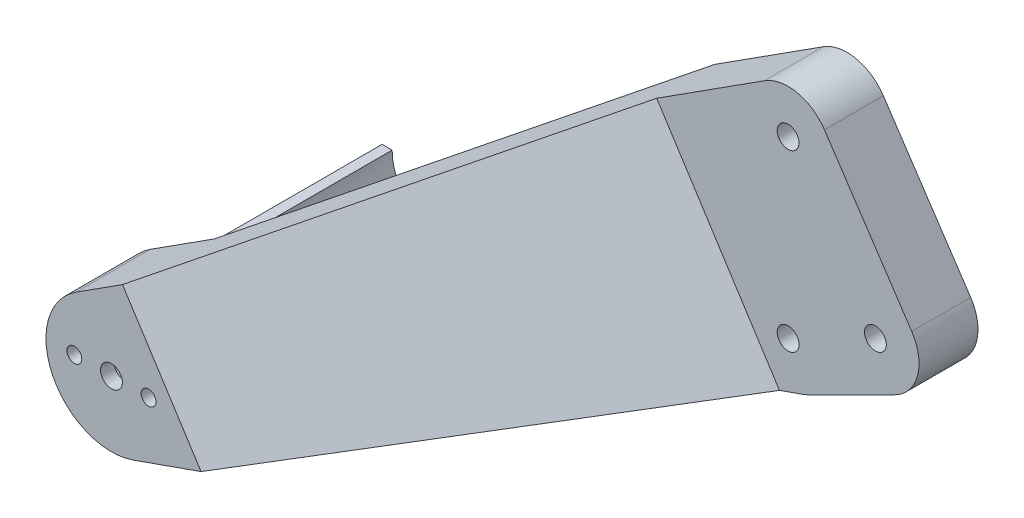
from build123d import *

# Parameters (mm, degrees)
BOSS_EXTRUDE1_DEPTH = 17
SKETCH2_R           = 2.5
CUT_EXTRUDE1_DEPTH  = 127.546434165
SKETCH3_R           = 1.7
CUT_EXTRUDE2_DEPTH  = 127.546434165
SKETCH7_R           = 12.7
CUT_EXTRUDE6_DEPTH  = 13
SKETCH4_R           = 5.5
CUT_EXTRUDE3_DEPTH  = 0.9
BOSS_EXTRUDE2_START = 60
BOSS_EXTRUDE2_DEPTH = 60
BOSS_EXTRUDE4_START = 51.5
BOSS_EXTRUDE4_DEPTH = 51.5
SKETCH12_R          = 2.5
CUT_EXTRUDE7_DEPTH  = 148.152981621
CUT_EXTRUDE8_DEPTH  = 137.561092173
CUT_EXTRUDE9_DEPTH  = 137.561092173


with BuildPart() as part:
    # Sketch1 → Boss-Extrude1 (new body)
    with BuildSketch(Plane.XY):
        with BuildLine():
            Line((3.328897286, -9.429657621), (-95.00665407, -44.144486432))
            ThreePointArc((-95.00665407, -44.144486432), (-113.476816743, -36.586001098), (-108.091360043, -17.369485653))
            Line((-108.091360043, -17.369485653), (-5.394240028, 48.420342898))
            ThreePointArc((-5.394240028, 48.420342898), (2.050554972, 49.787503477), (8.320502943, 45.547001962))
            Line((8.320502943, 45.547001962), (28.320502943, 15.547001962))
            ThreePointArc((28.320502943, 15.547001962), (29.664996488, 7.433320648), (24.472135955, 1.05572809))
            Line((24.472135955, 1.05572809), (4.472135955, -8.94427191))
            ThreePointArc((4.472135955, -8.94427191), (3.908059586, -9.204730863), (3.328897286, -9.429657621))
        make_face()
    extrude(amount=BOSS_EXTRUDE1_DEPTH)

    # Sketch2 → Cut-Extrude1 (cut, through all)
    with BuildSketch(Plane.XY.offset(17)):
        with Locations((-100, -30)):
            Circle(SKETCH2_R)
        Circle(SKETCH2_R)
        with Locations((0, 40)):
            Circle(SKETCH2_R)
        with Locations((20, 10)):
            Circle(SKETCH2_R)
    extrude(amount=-CUT_EXTRUDE1_DEPTH, mode=Mode.SUBTRACT)

    # Sketch3 → Cut-Extrude2 (cut, through all)
    with BuildSketch(Plane.XY.offset(17)):
        with Locations((-108.5, -30)):
            Circle(SKETCH3_R)
        with Locations((-91.5, -30)):
            Circle(SKETCH3_R)
    extrude(amount=-CUT_EXTRUDE2_DEPTH, mode=Mode.SUBTRACT)

    # Sketch7 → Cut-Extrude6 (cut)
    with BuildSketch(Plane(origin=(0, 0, 0), x_dir=(-1, 0, 0), z_dir=(0, 0, -1))):
        with Locations((100, -30)):
            Circle(SKETCH7_R)
    extrude(amount=-CUT_EXTRUDE6_DEPTH, mode=Mode.SUBTRACT)

    # Sketch4 → Cut-Extrude3 (cut)
    with BuildSketch(Plane(origin=(0, 0, 13), x_dir=(-1, 0, 0), z_dir=(0, 0, -1))):
        with Locations((100, -30)):
            Circle(SKETCH4_R)
    extrude(amount=-CUT_EXTRUDE3_DEPTH, mode=Mode.SUBTRACT)

    # Sketch8 → Boss-Extrude2 (add)
    with BuildSketch(Plane(origin=(0, 0, 0), x_dir=(-1, 0, 0), z_dir=(0, 0, -1)).offset(BOSS_EXTRUDE2_START)):
        with BuildLine():
            Line((112.7, -30), (115, -30))
            ThreePointArc((115, -30), (103.882285677, -44.488887394), (87.009618943, -37.5))
            Line((87.009618943, -37.5), (89.001477372, -36.35))
            ThreePointArc((89.001477372, -36.35), (103.287001873, -42.267257994), (112.7, -30))
        make_face()
    extrude(amount=-BOSS_EXTRUDE2_DEPTH)

    # Sketch10 → Boss-Extrude4 (add)
    with BuildSketch(Plane(origin=(0, 0, 0), x_dir=(-1, 0, 0), z_dir=(0, 0, -1)).offset(BOSS_EXTRUDE4_START)):
        with BuildLine():
            Line((-3.328897286, -9.429657621), (74.84338492, -37.026364581))
            Line((74.84338492, -37.026364581), (93.446242615, -7.987530595))
            Line((93.446242615, -7.987530595), (5.394240028, 48.420342898))
            ThreePointArc((5.394240028, 48.420342898), (-2.050554972, 49.787503477), (-8.320502943, 45.547001962))
            Line((-8.320502943, 45.547001962), (-28.320502943, 15.547001962))
            ThreePointArc((-28.320502943, 15.547001962), (-29.664996488, 7.433320648), (-24.472135955, 1.05572809))
            Line((-24.472135955, 1.05572809), (-4.472135955, -8.94427191))
            ThreePointArc((-4.472135955, -8.94427191), (-3.908059586, -9.204730863), (-3.328897286, -9.429657621))
        make_face()
    extrude(amount=-BOSS_EXTRUDE4_DEPTH)

    # Sketch12 → Cut-Extrude7 (cut, through all)
    with BuildSketch(Plane.XY.offset(17)):
        Circle(SKETCH12_R)
        with Locations((20, 10)):
            Circle(SKETCH12_R)
        with Locations((0, 40)):
            Circle(SKETCH12_R)
    extrude(amount=-CUT_EXTRUDE7_DEPTH, mode=Mode.SUBTRACT)

    # Sketch13 → Cut-Extrude8 (cut, through all)
    with BuildSketch(Plane(origin=(-23.562780313, 36.781212704, 0), x_dir=(0.8420342897751991, 0.5394240028426396, 0), z_dir=(-0.5394240028426396, 0.8420342897751991, 0))):
        Polygon((32.233260613, -17), (-87.766739387, -17), (-7.766739387, 38), (32.233260613, 38), (33.233260613, 38), (33.233260613, -17), align=None)
    extrude(amount=-CUT_EXTRUDE8_DEPTH, mode=Mode.SUBTRACT)

    # Sketch14 → Cut-Extrude9 (cut, through all)
    with BuildSketch(Plane(origin=(-23.562780313, 36.781212704, 0), x_dir=(0.8420342897751991, 0.5394240028426396, 0), z_dir=(-0.5394240028426396, 0.8420342897751991, 0))):
        Polygon((-82.993606259, 0), (-7.993606259, 51.5), (-82.993606259, 51.5), align=None)
    extrude(amount=-CUT_EXTRUDE9_DEPTH, mode=Mode.SUBTRACT)


solid = part.part
